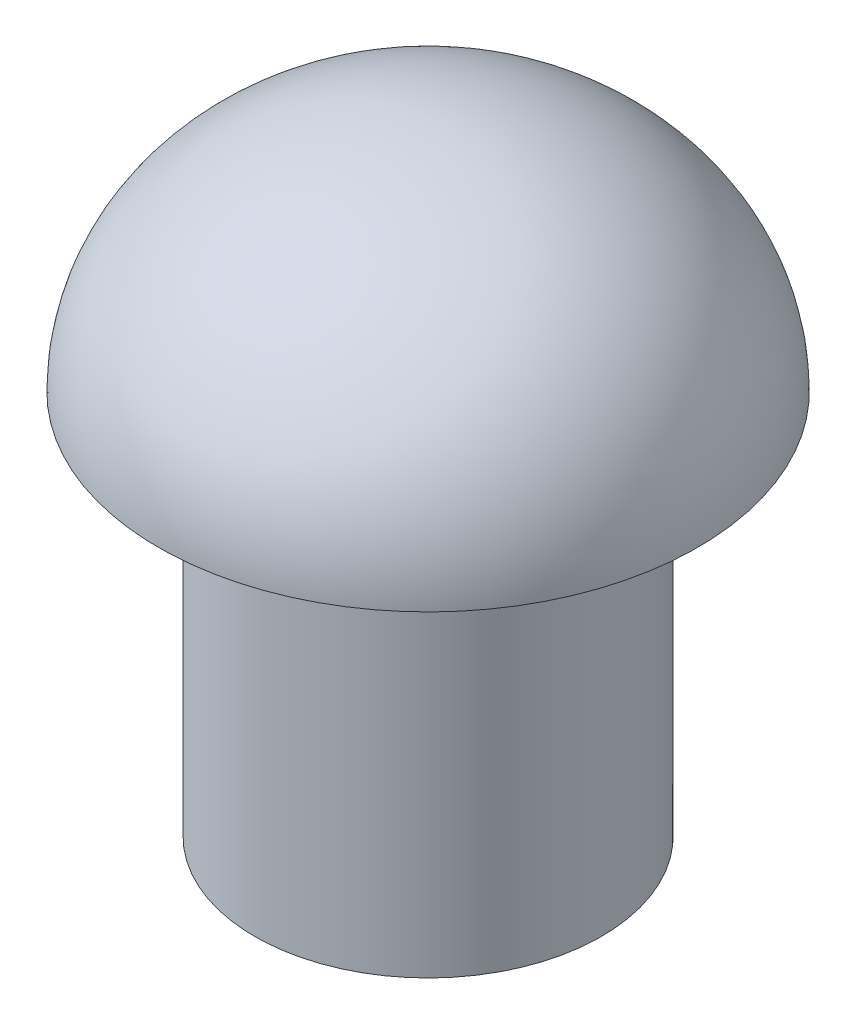
from build123d import *

# Parameters (mm, degrees)
SKETCH3_R           = 2.25
BOSS_EXTRUDE1_DEPTH = 5
SKETCH4_W           = 3
SKETCH4_H           = 3
CUT_EXTRUDE1_DEPTH  = 2


with BuildPart() as part:
    # Sketch1 → Revolve5 (revolve)
    with BuildSketch(Plane(origin=(0, 0, 0), x_dir=(0, 0, -1), z_dir=(1, 0, 0))):
        with BuildLine():
            Line((0, 3), (0, 0))
            Line((0, 0), (3.5, 0))
            add(Edge.make_bspline(
                [(3.5, 0), (3.5, 3), (0, 3)],
                knots=[3.141592654, 3.141592654, 3.141592654, 4.71238898, 4.71238898, 4.71238898], degree=2, weights=[1, 0.707106781, 1]))
        make_face()
    revolve(axis=Axis((0, 0, 0), (0, 1, 0)))

    # Sketch3 → Boss-Extrude1 (add)
    with BuildSketch(Plane.XZ):
        Circle(SKETCH3_R)
    extrude(amount=BOSS_EXTRUDE1_DEPTH)

    # Sketch4 → Cut-Extrude1 (cut)
    with BuildSketch(Plane.XZ.offset(5)):
        Rectangle(SKETCH4_W, SKETCH4_H)
    extrude(amount=-CUT_EXTRUDE1_DEPTH, mode=Mode.SUBTRACT)


solid = part.part
